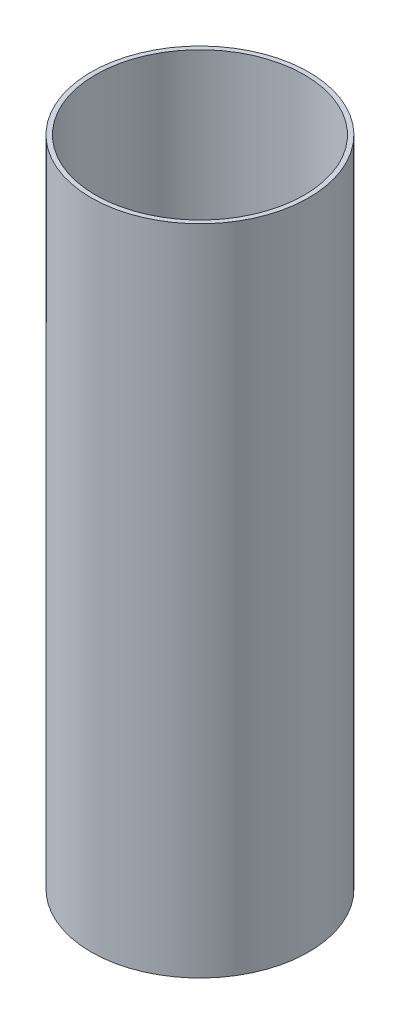
from build123d import *

# Parameters (mm, degrees)
SKETCH2_R           = 76.2
SKETCH2_R_2         = 73.025
BOSS_EXTRUDE1_DEPTH = 457.2


with BuildPart() as part:
    # Sketch2 → Boss-Extrude1 (new body)
    with BuildSketch(Plane(origin=(0, 0, 0), x_dir=(1, 0, 0), z_dir=(0, 1, 0))):
        Circle(SKETCH2_R)
        Circle(SKETCH2_R_2, mode=Mode.SUBTRACT)
    extrude(amount=BOSS_EXTRUDE1_DEPTH)


solid = part.part
